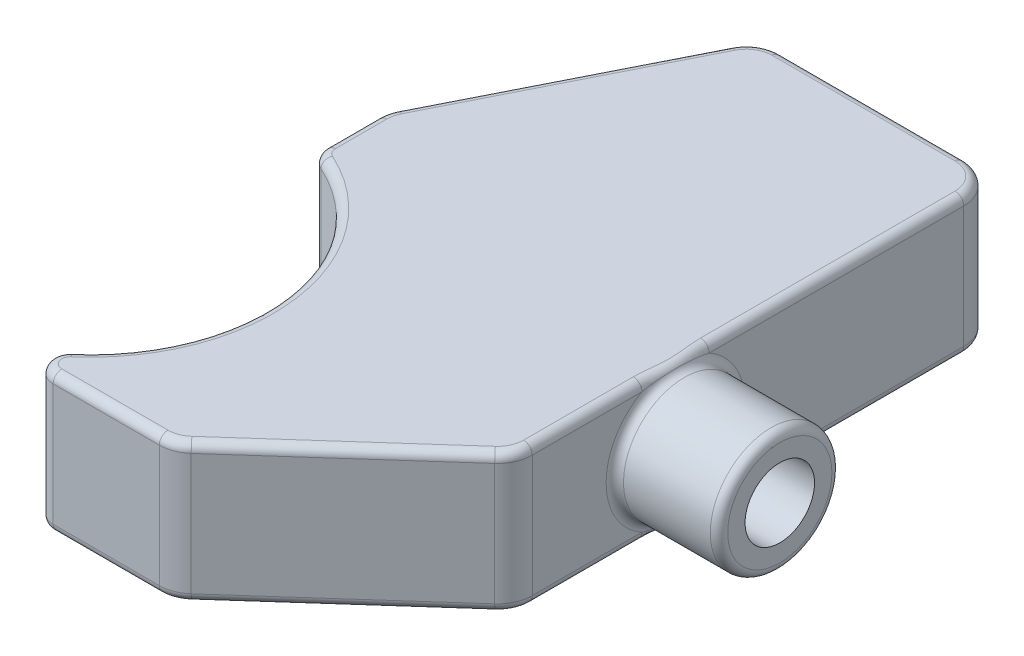
from build123d import *

# Parameters (mm, degrees)
BOSS_EXTRUDE3_DEPTH = 8
SKETCH5_R           = 3.5
BOSS_EXTRUDE4_DEPTH = 6
CUT_EXTRUDE4_DEPTH  = 11
SKETCH8_R           = 2
CUT_EXTRUDE6_DEPTH  = 6
FILLET4_R           = 0.5
FILLET5_R           = 0.5
FILLET6_R           = 0.5
FILLET7_R           = 0.5


with BuildPart() as part:
    # Sketch2 → Boss-Extrude3 (new body)
    with BuildSketch(Plane(origin=(0, 0, 0), x_dir=(1, 0, 0), z_dir=(0, 1, 0))):
        with BuildLine():
            Line((-52.986366507, -9.86293556), (-46.875173859, -9.86293556))
            ThreePointArc((-46.875173859, -9.86293556), (-46.162915062, -9.731808859), (-45.544052412, -9.355622967))
            Line((-45.544052412, -9.355622967), (-36.306548093, -1.117970492))
            ThreePointArc((-36.306548093, -1.117970492), (-35.812533532, -0.443133043), (-35.63766954, 0.374716915))
            Line((-35.63766954, 0.374716915), (-35.63766954, 25.214712135))
            ThreePointArc((-35.63766954, 25.214712135), (-36.223455977, 26.628925698), (-37.63766954, 27.214712135))
            Line((-37.63766954, 27.214712135), (-48.162498073, 27.214712135))
            ThreePointArc((-48.162498073, 27.214712135), (-49.211705906, 26.91740498), (-49.948976743, 26.113875058))
            Line((-49.948976743, 26.113875058), (-56.374690107, 13.347112122))
            ThreePointArc((-56.374690107, 13.347112122), (-56.534099068, 12.910032882), (-56.588211437, 12.4479492))
            Line((-56.588211437, 12.4479492), (-56.588211437, 9.484742958))
            ThreePointArc((-56.588211437, 9.484742958), (-56.429448332, 8.944076251), (-56.003570463, 8.575085396))
            ThreePointArc((-56.003570463, 8.575085396), (-50.256216568, 0.882541429), (-53.63825689, -8.104622347))
            ThreePointArc((-53.63825689, -8.104622347), (-53.924000021, -9.210560924), (-52.986366507, -9.86293556))
        make_face()
    extrude(amount=BOSS_EXTRUDE3_DEPTH)

    # Sketch5 → Boss-Extrude4 (add)
    with BuildSketch(Plane(origin=(-35.63766954, 0, 0), x_dir=(0, 0, -1), z_dir=(1, 0, 0))):
        with Locations(Location((8.625486842, 4, 0), (0, 0, 180))):
            Circle(SKETCH5_R)
    extrude(amount=BOSS_EXTRUDE4_DEPTH)

    # Sketch6 → Cut-Extrude4 (cut)
    with BuildSketch(Plane(origin=(-29.63766954, 0, 0), x_dir=(0, 0, -1), z_dir=(1, 0, 0))):
        Polygon((9.467738832, 5.794574307), (8.252058704, 5.946904411), (7.179015432, 5.355583202), (6.658475074, 4.246475285), (6.889266356, 3.043222187), (7.783234851, 2.205425693), (8.99891498, 2.053095589), (10.071958252, 2.644416798), (10.592498609, 3.753524715), (10.361707327, 4.956777813), align=None)
    extrude(amount=-CUT_EXTRUDE4_DEPTH, mode=Mode.SUBTRACT)

    # Sketch8 → Cut-Extrude6 (cut)
    with BuildSketch(Plane(origin=(-29.63766954, 0, 0), x_dir=(0, 0, -1), z_dir=(1, 0, 0))):
        with Locations((8.625486842, 4)):
            Circle(SKETCH8_R)
    extrude(amount=-CUT_EXTRUDE6_DEPTH, mode=Mode.SUBTRACT)

    # Fillet4
    fillet4_edges = [part.edges().sort_by_distance(p)[0] for p in [
        (-29.63766954, 4, -12.125486842),
    ]]
    fillet(fillet4_edges, radius=FILLET4_R)

    # Fillet5
    fillet5_edges = [part.edges().sort_by_distance(p)[0] for p in [
        (-35.63766954, 4, -12.125486842),
    ]]
    fillet(fillet5_edges, radius=FILLET5_R - 0.0001)  # a hair under: the kernel refuses the full size

    # Fillet6
    fillet6_edges = [part.edges().sort_by_distance(p)[0] for p in [
        (-35.63766954, 8, -12.794714525),
        (-49.211705906, 8, -26.91740498),
        (-53.161833425, 8, -19.73049359),
        (-56.534099068, 8, -12.910032882),
        (-56.588211437, 8, -10.966346079),
        (-56.429448332, 8, -8.944076251),
        (-50.256216568, 8, -0.882541429),
        (-53.924000021, 8, 9.210560924),
        (-49.930770183, 8, 9.86293556),
        (-46.162915062, 8, 9.731808859),
        (-40.925300253, 8, 5.236796729),
        (-36.223455977, 8, -26.628925698),
        (-35.812533532, 8, 0.443133043),
        (-35.63766954, 8, -12.794714525),
        (-42.900083806, 8, -27.214712135),
    ]]
    fillet(fillet6_edges, radius=FILLET6_R)

    # Fillet7
    fillet7_edges = [part.edges().sort_by_distance(p)[0] for p in [
        (-35.63766954, 0, -12.794714525),
        (-35.63766954, 0, -12.794714525),
        (-35.812533532, 0, 0.443133043),
        (-40.925300253, 0, 5.236796729),
        (-46.162915062, 0, 9.731808859),
        (-49.930770183, 0, 9.86293556),
        (-53.924000021, 0, 9.210560924),
        (-50.256216568, 0, -0.882541429),
        (-56.429448332, 0, -8.944076251),
        (-56.588211437, 0, -10.966346079),
        (-56.534099068, 0, -12.910032882),
        (-53.161833425, 0, -19.73049359),
        (-49.211705906, 0, -26.91740498),
        (-42.900083806, 0, -27.214712135),
        (-36.223455977, 0, -26.628925698),
    ]]
    fillet(fillet7_edges, radius=FILLET7_R)


solid = part.part
